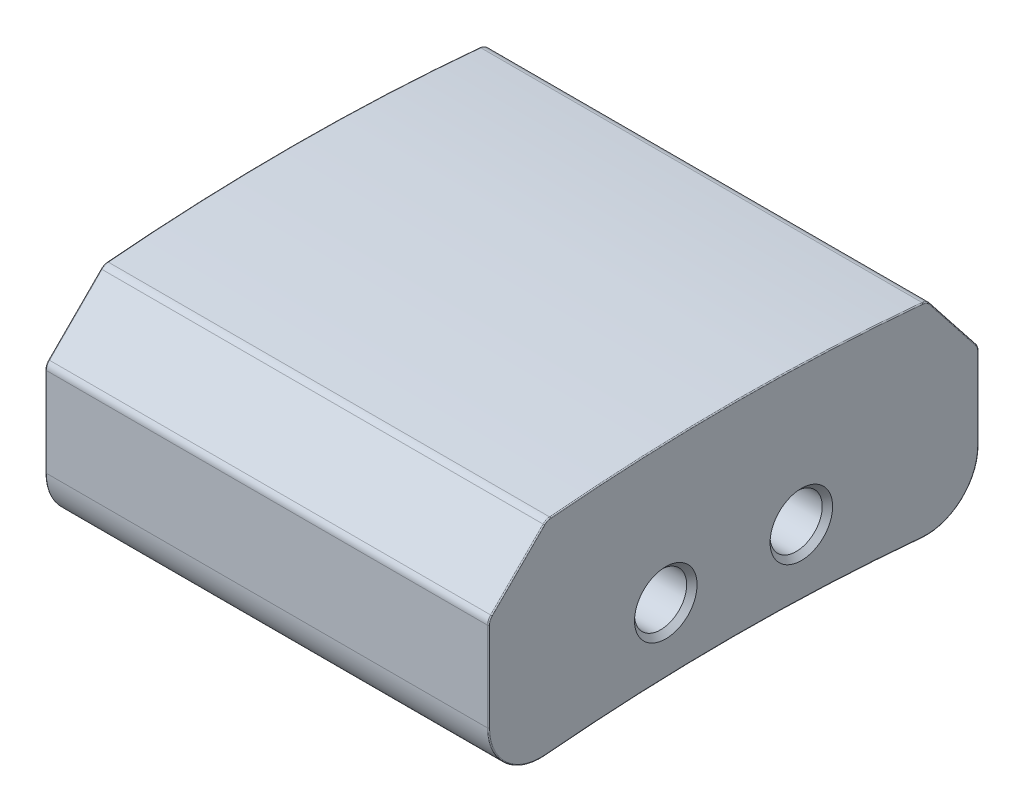
from build123d import *

# Parameters (mm, degrees)
SKETCH1_W           = 8.5
SKETCH1_H           = 9.4
BOSS_EXTRUDE1_DEPTH = 4.2
CUT_EXTRUDE1_DEPTH  = 14.2
CHAMFER1_SIZE       = 1.142109378
CHAMFER1_SIZE_2     = 1
FILLET1_R           = 1
FILLET2_R           = 0.2
FILLET3_R           = 0.02
SKETCH3_R           = 0.5
CUT_EXTRUDE2_DEPTH  = 14.2
CHAMFER2_SIZE       = 0.1


with BuildPart() as part:
    # Sketch1 → Boss-Extrude1 (new body)
    with BuildSketch(Plane(origin=(0, 0, 0), x_dir=(1, 0, 0), z_dir=(0, 1, 0))):
        Rectangle(SKETCH1_W, SKETCH1_H)
    extrude(amount=BOSS_EXTRUDE1_DEPTH)

    # Sketch2 → Cut-Extrude1 (cut)
    with BuildSketch(Plane(origin=(4.25, 0, 0), x_dir=(0, 0, -1), z_dir=(1, 0, 0))):
        with BuildLine():
            Line((-4.7, 3.9), (-5.253535024, 5.241651662))
            Line((-5.253535024, 5.241651662), (3.889156526, 7.141243929))
            Line((3.889156526, 7.141243929), (5.679183493, 5.077233243))
            Line((5.679183493, 5.077233243), (4.7, 3.9))
            ThreePointArc((4.7, 3.9), (0, 4.177084699), (-4.7, 3.9))
        make_face()
        with BuildLine():
            Line((4.717394395, 0), (0, -2.904825783))
            Line((0, -2.904825783), (-4.70037365, 0))
            ThreePointArc((-4.70037365, 0), (0.008510373, 0.278136861), (4.717394395, 0))
        make_face()
    extrude(amount=-CUT_EXTRUDE1_DEPTH, mode=Mode.SUBTRACT)

    # Chamfer1
    # the kernel refuses this chamfer: 1.142109378, 1 mm, written as the material it takes off along each edge
    with BuildSketch(Plane(origin=(7.19581135, 3.9, -4.7), x_dir=(0, -1, 0), z_dir=(-1, 0, 0))) as chamfer1_piece_1:
        with BuildLine():
            Line((CHAMFER1_SIZE, 0), (-0.103952397, 0.982391987))
            ThreePointArc((-0.103952397, 0.982391987), (-0.056683865, 0.506732753), (0, 0))
            Line((0, 0), (CHAMFER1_SIZE, 0))
        make_face()
    extrude(amount=14.391622699, mode=Mode.SUBTRACT)
    with BuildSketch(Plane(origin=(7.145211131, 3.9, 4.7), x_dir=(0, 0.10355747110922714, -0.994623471559696), z_dir=(-1, 0, 0))) as chamfer1_piece_2:
        with BuildLine():
            Line((1.122251325, 0), (-CHAMFER1_SIZE_2 * 0.103557471109, CHAMFER1_SIZE_2 * 0.99462347156))
            Line((-CHAMFER1_SIZE_2 * 0.103557471109, CHAMFER1_SIZE_2 * 0.99462347156), (0, 0))
            ThreePointArc((0, 0), (0.578858696, -0.003932038), (1.122251325, 0))
        make_face()
    extrude(amount=14.290422262, mode=Mode.SUBTRACT)

    # Fillet1
    fillet1_edges = [part.edges().sort_by_distance(p)[0] for p in [
        (0, 0.002058181, -4.7),
        (0, 4.4293e-05, 4.7),
    ]]
    fillet(fillet1_edges, radius=FILLET1_R)

    # Fillet2
    fillet2_edges = [part.edges().sort_by_distance(p)[0] for p in [
        (0, 2.757890622, -4.7),
        (0, 4.016217509, 3.583782491),
        (0, 4.003952397, -3.717608013),
        (0, 2.9, 4.7),
    ]]
    fillet(fillet2_edges, radius=FILLET2_R)

    # Fillet3
    fillet3_edges = [part.edges().sort_by_distance(p)[0] for p in [
        (4.25, 0.278135992, -0.000173553),
        (4.25, 0.373361144, -4.374523412),
        (4.25, 0.371678264, 4.374369531),
        (-4.25, 0.278135992, -0.000173553),
        (-4.25, 0.373361144, -4.374523412),
        (-4.25, 0.371678264, 4.374369531),
        (4.25, 1.900073524, -4.7),
        (-4.25, 1.900073524, -4.7),
        (4.25, 1.963614788, 4.7),
        (4.25, 3.374434854, -4.21391807),
        (4.25, 4.177038875, -0.06054719),
        (4.25, 3.461723118, 4.138276882),
        (4.25, 2.893693974, 4.684775907),
        (4.25, 4.004681229, 3.578291648),
        (4.25, 3.988486823, -3.709084943),
        (4.25, 2.754062042, -4.688959975),
        (-4.25, 3.374434854, -4.21391807),
        (-4.25, 1.963614788, 4.7),
        (-4.25, 3.461723118, 4.138276882),
        (-4.25, 4.177038875, -0.06054719),
        (-4.25, 2.893693974, 4.684775907),
        (-4.25, 4.004681229, 3.578291648),
        (-4.25, 3.988486823, -3.709084943),
        (-4.25, 2.754062042, -4.688959975),
    ]]
    fillet(fillet3_edges, radius=FILLET3_R)

    # Sketch3 → Cut-Extrude2 (cut)
    with BuildSketch(Plane.ZY.offset(4.25)):
        with Locations((-1.3, 1.5)):
            Circle(SKETCH3_R)
        with Locations((1.3, 1.5)):
            Circle(SKETCH3_R)
    extrude(amount=-CUT_EXTRUDE2_DEPTH, mode=Mode.SUBTRACT)

    # Chamfer2
    chamfer2_edges = [part.edges().sort_by_distance(p)[0] for p in [
        (4.25, 1.5, -1.8),
        (-4.25, 1.5, -1.8),
        (4.25, 1.5, 0.8),
        (-4.25, 1.5, 0.8),
    ]]
    chamfer(chamfer2_edges, length=CHAMFER2_SIZE)


solid = part.part
